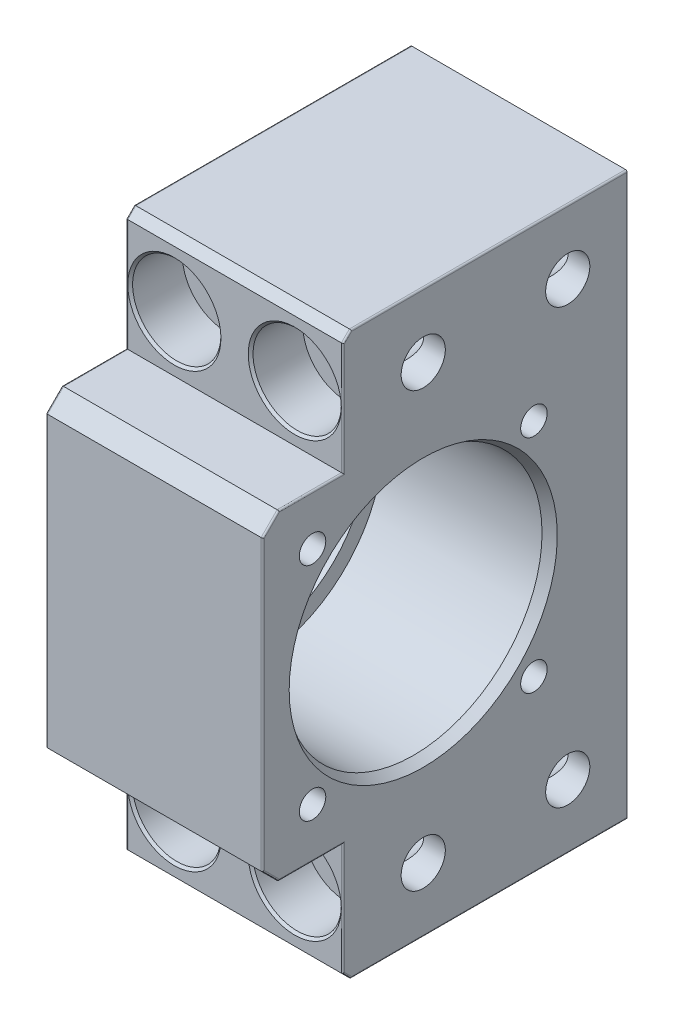
from build123d import *

# Parameters (mm, degrees)
SKETCH1_W                                    = 70
SKETCH1_H                                    = 48
BOSS_EXTRUDE1_DEPTH                          = 27
SKETCH2_W                                    = 10
SKETCH2_H                                    = 15
CUT_EXTRUDE1_DEPTH                           = 51.29910536
HOLE1_D                                      = 28
HOLE1_CBORE_D                                = 32
HOLE1_CBORE_DEPTH                            = 21
F_5_5_5_5_DIAMETER_HOLE1_D                   = 5.5
CBORE_FOR_M6_HEX_SOCKET_THIN_HEAD_CA_2_COUNT = 2
CBORE_FOR_M6_HEX_SOCKET_THIN_HEAD_CA_2_PITCH = 15
CBORE_FOR_M6_HEX_SOCKET_THIN_HEAD_CA_3_COUNT = 2
CBORE_FOR_M6_HEX_SOCKET_THIN_HEAD_CA_3_PITCH = 56.044625077
CBORE_FOR_M6_HEX_SOCKET_THIN_HEAD_CA_4_COUNT = 2
CBORE_FOR_M6_HEX_SOCKET_THIN_HEAD_CA_4_PITCH = 54
TAP_DRILL_FOR_M4X0_7_TAP1_D                  = 3.3
TAP_DRILL_FOR_M4X0_7_TAP1_DEPTH              = 12
TAP_DRILL_FOR_M4X0_7_TAP1_TIP                = 0.858935633
CHAMFER1_SIZE                                = 1
CHAMFER3_SIZE                                = 2
CHAMFER2_SIZE                                = 0.7
CHAMFER2_SIZE2                               = 1.2
CHAMFER4_SIZE                                = 0.5
FILLET1_R                                    = 0.2
SKETCH18_W                                   = 2.6
SKETCH18_H                                   = 70
CUT_EXTRUDE2_DEPTH                           = 51.299105414


with BuildPart() as part:
    # Sketch1 → Boss-Extrude1 (new body)
    with BuildSketch(Plane(origin=(-13.5, 0, 0), x_dir=(0, -1, 0), z_dir=(-1, 0, 0))):
        Rectangle(SKETCH1_W, SKETCH1_H)
    extrude(amount=-BOSS_EXTRUDE1_DEPTH)

    # Sketch2 → Cut-Extrude1 (cut, through all)
    with BuildSketch(Plane(origin=(13.5, 0, 0), x_dir=(0, 0, -1), z_dir=(1, 0, 0))):
        with Locations((-19, 27.5)):
            Rectangle(SKETCH2_W, SKETCH2_H)
        with Locations((-19, -27.5)):
            Rectangle(SKETCH2_W, SKETCH2_H)
    extrude(amount=-CUT_EXTRUDE1_DEPTH, mode=Mode.SUBTRACT)

    # Hole1 (through all)
    with Locations(Plane(origin=(13.5, 0, 0), x_dir=(0, 0, -1), z_dir=(1, 0, 0))):
        with Locations((-4, 0)):
            CounterBoreHole(HOLE1_D / 2, HOLE1_CBORE_D / 2, HOLE1_CBORE_DEPTH)

    # Ø5.5 (5.5) Diameter Hole1 (through all)
    with Locations(Plane.ZY.offset(13.5)):
        with Locations((4, 27), (-14, 27), (4, -27), (-14, -27)):
            Hole(F_5_5_5_5_DIAMETER_HOLE1_D / 2)

    # Sketch8 → CBORE for M6 Hex Socket Thin Head Cap Screw1 (revolve, cut)
    with BuildSketch(Plane(origin=(-7.5, -27, 14), x_dir=(0, -1, 0), z_dir=(1, 0, 0))):
        Polygon((0, 0), (0, 38), (3.6, 38), (3.3, 37.7), (3.3, 6.5), (5.5, 6.5), (5.5, 0.3), (5.8, 0), align=None)
    cbore_for_m6_hex_socket_thin_head_cap_sc = revolve(axis=Axis((-7.5, -27, 20.35), (0, 0, -1)), mode=Mode.SUBTRACT)

    # CBORE for M6 Hex Socket Thin Head Ca 2: CBORE for M6 Hex Socket Thin Head Cap Screw1 ×2
    with Locations(*[(i * CBORE_FOR_M6_HEX_SOCKET_THIN_HEAD_CA_2_PITCH, 0, 0) for i in range(1, CBORE_FOR_M6_HEX_SOCKET_THIN_HEAD_CA_2_COUNT)]):
        add(cbore_for_m6_hex_socket_thin_head_cap_sc, mode=Mode.SUBTRACT)

    # CBORE for M6 Hex Socket Thin Head Ca 3: CBORE for M6 Hex Socket Thin Head Cap Screw1 ×2
    with Locations(*[Vector(0.26764386378609467, 0.9635179096299407, 0) * (i * CBORE_FOR_M6_HEX_SOCKET_THIN_HEAD_CA_3_PITCH) for i in range(1, CBORE_FOR_M6_HEX_SOCKET_THIN_HEAD_CA_3_COUNT)]):
        add(cbore_for_m6_hex_socket_thin_head_cap_sc, mode=Mode.SUBTRACT)

    # CBORE for M6 Hex Socket Thin Head Ca 4: CBORE for M6 Hex Socket Thin Head Cap Screw1 ×2
    with Locations(*[(0, i * CBORE_FOR_M6_HEX_SOCKET_THIN_HEAD_CA_4_PITCH, 0) for i in range(1, CBORE_FOR_M6_HEX_SOCKET_THIN_HEAD_CA_4_COUNT)]):
        add(cbore_for_m6_hex_socket_thin_head_cap_sc, mode=Mode.SUBTRACT)

    # Tap Drill for M4x0.7 Tap1
    with Locations(Plane(origin=(13.5, 0, 0), x_dir=(0, 0, 1), z_dir=(1, 0, 0))):
        with Locations((-9.788582233, -13.788582233), (17.788582233, -13.788582233), (17.788582233, 13.788582233), (-9.788582233, 13.788582233)):
            Hole(TAP_DRILL_FOR_M4X0_7_TAP1_D / 2, depth=TAP_DRILL_FOR_M4X0_7_TAP1_DEPTH)
            with Locations((0, 0, -(TAP_DRILL_FOR_M4X0_7_TAP1_DEPTH + TAP_DRILL_FOR_M4X0_7_TAP1_TIP / 2))):  # 125° drill point
                Cone(0, TAP_DRILL_FOR_M4X0_7_TAP1_D / 2, TAP_DRILL_FOR_M4X0_7_TAP1_TIP, mode=Mode.SUBTRACT)

    # Chamfer1
    chamfer1_edges = [part.edges().sort_by_distance(p)[0] for p in [
        (0, 35, 14),
        (0, -35, 14),
        (0, -35, -24),
        (0, 35, -24),
    ]]
    chamfer(chamfer1_edges, length=CHAMFER1_SIZE)

    # Chamfer3
    chamfer3_edges = [part.edges().sort_by_distance(p)[0] for p in [
        (0, 20, 24),
        (0, -20, 24),
    ]]
    chamfer(chamfer3_edges, length=CHAMFER3_SIZE)

    # Chamfer2
    chamfer2_edges = [part.edges().sort_by_distance(p)[0] for p in [
        (13.5, 0, 20),
    ]]
    chamfer2_side = [part.faces().sort_by_distance(p)[0] for p in [
        (13.5, -19.151236193, 18),
    ]]
    chamfer(chamfer2_edges, length=CHAMFER2_SIZE, length2=CHAMFER2_SIZE2, reference=chamfer2_side[0])

    # Chamfer4
    chamfer4_edges = [part.edges().sort_by_distance(p)[0] for p in [
        (-13.5, 0, -10),
    ]]
    chamfer(chamfer4_edges, length=CHAMFER4_SIZE)

    # Fillet1
    fillet1_edges = [part.edges().sort_by_distance(p)[0] for p in [
        (-13.5, 0, -24),
        (13.5, 0, -24),
        (-13.5, 35, -5),
        (-13.5, -35, -5),
        (-13.5, -27, 14),
        (-13.5, 34.5, 13.5),
        (-13.5, 34.5, -23.5),
        (-13.5, -34.5, 13.5),
        (-13.5, -34.5, -23.5),
        (13.5, -35, -5),
        (13.5, -27, 14),
        (13.5, 35, -5),
        (13.5, 34.5, 13.5),
        (13.5, 34.5, -23.5),
        (13.5, -34.5, 13.5),
        (13.5, -34.5, -23.5),
        (-13.5, 27, 14),
        (13.5, 0, 24),
        (-13.5, 0, 24),
        (13.5, 20, 18),
        (13.5, 19, 23),
        (13.5, -19, 23),
        (-13.5, 20, 18),
        (-13.5, 19, 23),
        (-13.5, -19, 23),
        (13.5, 27, 14),
        (-13.5, -20, 18),
        (13.5, -20, 18),
    ]]
    fillet(fillet1_edges, radius=FILLET1_R - 0.0001)  # a hair under: the kernel refuses the full size

    # Sketch18 → Cut-Extrude2 (cut, through all)
    with BuildSketch(Plane.ZY.offset(13.5)):
        with Locations((-22.7, 0)):
            Rectangle(SKETCH18_W, SKETCH18_H)
    extrude(amount=-CUT_EXTRUDE2_DEPTH, mode=Mode.SUBTRACT)


solid = part.part
